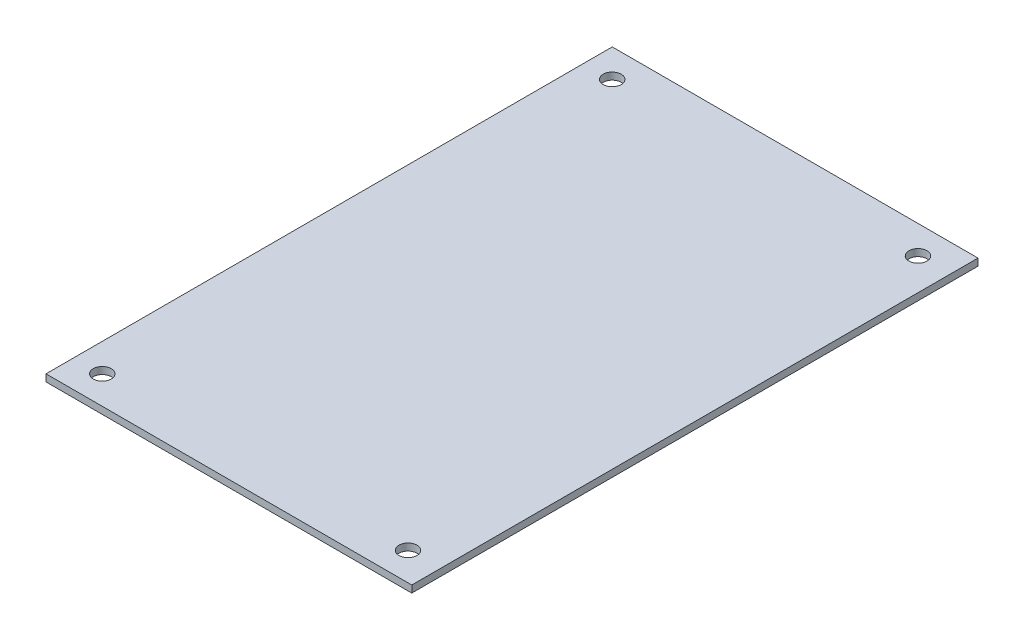
from build123d import *

# Parameters (mm, degrees)
SKETCH3_W           = 330.2
SKETCH3_H           = 6.35
BOSS_EXTRUDE1_DEPTH = 511.175
SKETCH4_R           = 8.128
CUT_EXTRUDE1_DEPTH  = 609.582158073


with BuildPart() as part:
    # Sketch3 → Boss-Extrude1 (new body)
    with BuildSketch(Plane.XY):
        with Locations((165.1, 3.175)):
            Rectangle(SKETCH3_W, SKETCH3_H)
    extrude(amount=-BOSS_EXTRUDE1_DEPTH)

    # Sketch4 → Cut-Extrude1 (cut, through all)
    with BuildSketch(Plane(origin=(0, 0, 0), x_dir=(1, 0, 0), z_dir=(0, 1, 0))):
        with Locations((25.4, 25.4)):
            Circle(SKETCH4_R)
        with Locations((301.399138423, 25.4)):
            Circle(SKETCH4_R)
        with Locations((301.399138423, 485.775)):
            Circle(SKETCH4_R)
        with Locations((25.4, 485.775)):
            Circle(SKETCH4_R)
    extrude(amount=CUT_EXTRUDE1_DEPTH, mode=Mode.SUBTRACT)


solid = part.part
